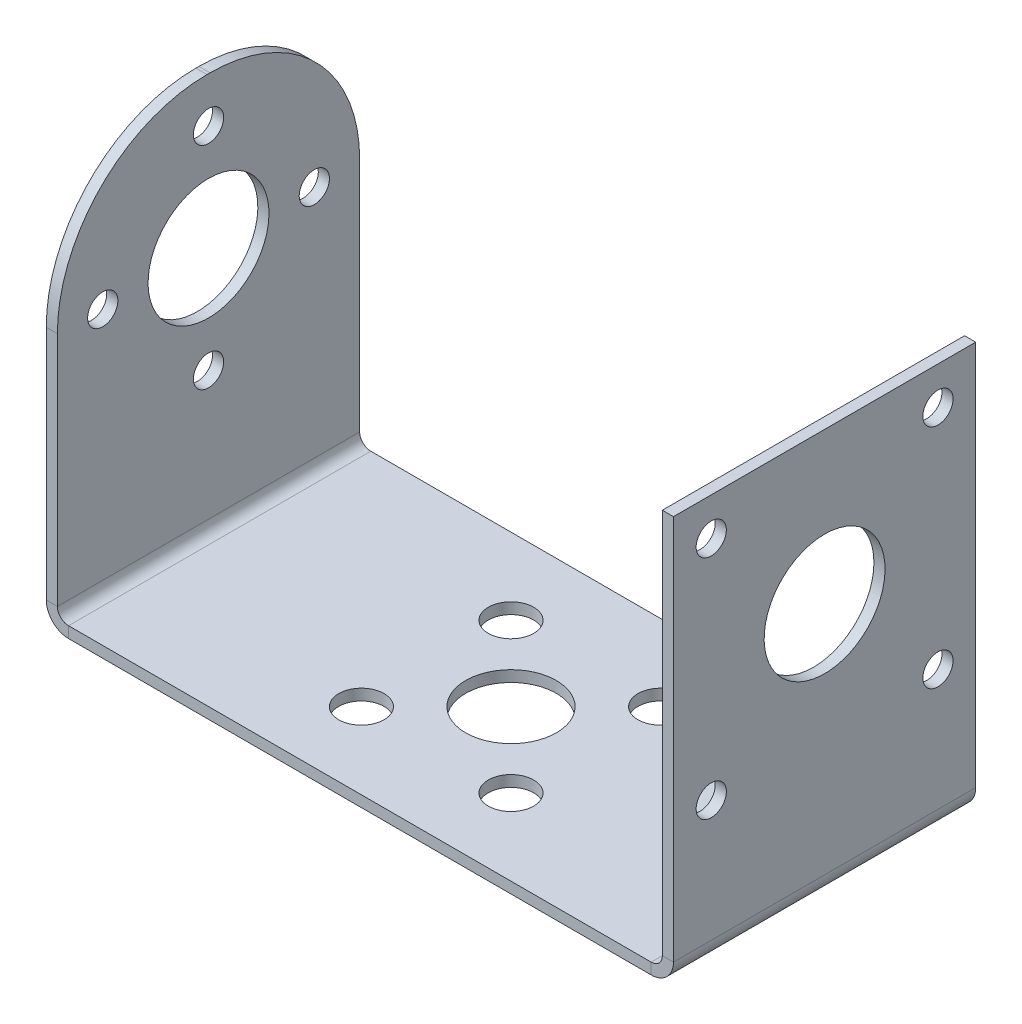
from build123d import *

# Parameters (mm, degrees)
SKETCH_1_W                       = 41.5
SKETCH_1_H                       = 20
SKETCH_1_R                       = 3
SKETCH_1_R_2                     = 1.5
SM_BASE_FLANGE_1_DEPTH           = 0.7366
SM_EDGE_FLANGE_1_STRIP_W         = 4.4196
SM_EDGE_FLANGE_1_STRIP_H         = 0.7366
SM_EDGE_FLANGE_1_STRIP_CUT_DEPTH = 20
SM_EDGE_FLANGE_1_DEPTH           = 20
SM_EDGE_FLANGE_1_PROFILE_R       = 1
SM_EDGE_FLANGE_1_PROFILE_R_2     = 4
SM_EDGE_FLANGE_1_FLAT_DEPTH      = 0.7366
SM_EDGE_FLANGE_2_STRIP_W         = 4.4196
SM_EDGE_FLANGE_2_STRIP_H         = 0.7366
SM_EDGE_FLANGE_2_STRIP_CUT_DEPTH = 20
SM_EDGE_FLANGE_2_DEPTH           = 20
CUT_EXTRUDE_START                = -10
SKETCH_14_R                      = 4
SKETCH_14_R_2                    = 1
CUT_EXTRUDE_1_DEPTH              = 10


# Sheet-metal steps are written as plain solids
with BuildPart() as part:
    # Sketch 1 → 基体-法兰1 (new body)
    with BuildSketch(Plane(origin=(0, 0, 0), x_dir=(1, 0, 0), z_dir=(0, 1, 0))):
        Rectangle(SKETCH_1_W, SKETCH_1_H)
        with Locations(Location((0, 0, 0), (0, 0, 270))):
            Circle(SKETCH_1_R, mode=Mode.SUBTRACT)
        with Locations(Location((4.9495, 4.9495, 0), (0, 0, 270))):
            Circle(SKETCH_1_R_2, mode=Mode.SUBTRACT)
        with Locations(Location((-4.9495, 4.9495, 0), (0, 0, 270))):
            Circle(SKETCH_1_R_2, mode=Mode.SUBTRACT)
        with Locations(Location((-4.9495, -4.9495, 0), (0, 0, 270))):
            Circle(SKETCH_1_R_2, mode=Mode.SUBTRACT)
        with Locations(Location((4.9495, -4.9495, 0), (0, 0, 270))):
            Circle(SKETCH_1_R_2, mode=Mode.SUBTRACT)
    extrude(amount=-SM_BASE_FLANGE_1_DEPTH)

    # 边线-法兰1 strip (across the edge) → 边线-法兰1 strip cut (cut)
    with BuildSketch(Plane(origin=(-20.75, 0, -10), x_dir=(1, 0, 0), z_dir=(0, 0, 1))):
        with Locations((-0.7366, -0.3683)):
            Rectangle(SM_EDGE_FLANGE_1_STRIP_W, SM_EDGE_FLANGE_1_STRIP_H)
    extrude(amount=SM_EDGE_FLANGE_1_STRIP_CUT_DEPTH, mode=Mode.SUBTRACT)

    # 边线-法兰1 bend section (across the edge) → 边线-法兰1 (add)
    with BuildSketch(Plane(origin=(-20.75, 0, -10), x_dir=(1, 0, 0), z_dir=(0, 0, 1))):
        with BuildLine():
            Line((0, 0.7366), (0.7366, 0.7366))
            ThreePointArc((0.7366, 0.7366), (0.952345145, 0.215745145), (1.4732, 0))
            Line((1.4732, 0), (1.4732, -0.7366))
            ThreePointArc((1.4732, -0.7366), (0.43149029, -0.30510971), (0, 0.7366))
        make_face()
    extrude(amount=SM_EDGE_FLANGE_1_DEPTH)

    # 边线-法兰1 profile (on flange) → 边线-法兰1 flat (add)
    with BuildSketch(Plane.ZY.offset(20.75)):
        with BuildLine():
            Line((-10, 0.7366), (10, 0.7366))
            Line((10, 0.7366), (10, 16.3634))
            ThreePointArc((10, 16.3634), (7.100357134, 23.363757134), (0.1, 26.2634))
            Line((0.1, 26.2634), (-0.1, 26.2634))
            ThreePointArc((-0.1, 26.2634), (-7.100357134, 23.363757134), (-10, 16.3634))
            Line((-10, 16.3634), (-10, 0.7366))
        make_face()
        with Locations((0, 9.2634)):
            Circle(SM_EDGE_FLANGE_1_PROFILE_R, mode=Mode.SUBTRACT)
        with Locations((7, 16.2634)):
            Circle(SM_EDGE_FLANGE_1_PROFILE_R, mode=Mode.SUBTRACT)
        with Locations((0, 16.2634)):
            Circle(SM_EDGE_FLANGE_1_PROFILE_R_2, mode=Mode.SUBTRACT)
        with Locations((-7, 16.2634)):
            Circle(SM_EDGE_FLANGE_1_PROFILE_R, mode=Mode.SUBTRACT)
        with Locations((0, 23.2634)):
            Circle(SM_EDGE_FLANGE_1_PROFILE_R, mode=Mode.SUBTRACT)
    extrude(amount=-SM_EDGE_FLANGE_1_FLAT_DEPTH)

    # 边线-法兰2 strip (across the edge) → 边线-法兰2 strip cut (cut)
    with BuildSketch(Plane(origin=(20.75, 0, 10), x_dir=(-1, 0, 0), z_dir=(0, 0, -1))):
        with Locations((-0.7366, -0.3683)):
            Rectangle(SM_EDGE_FLANGE_2_STRIP_W, SM_EDGE_FLANGE_2_STRIP_H)
    extrude(amount=SM_EDGE_FLANGE_2_STRIP_CUT_DEPTH, mode=Mode.SUBTRACT)

    # 边线-法兰2 section (across the edge) → 边线-法兰2 (add)
    with BuildSketch(Plane(origin=(20.75, 0, 10), x_dir=(-1, 0, 0), z_dir=(0, 0, -1))):
        with BuildLine():
            Line((0, 0.7366), (0, 26.2634))
            Line((0, 26.2634), (0.7366, 26.2634))
            Line((0.7366, 26.2634), (0.7366, 0.7366))
            ThreePointArc((0.7366, 0.7366), (0.952345145, 0.215745145), (1.4732, 0))
            Line((1.4732, 0), (1.4732, -0.7366))
            ThreePointArc((1.4732, -0.7366), (0.43149029, -0.30510971), (0, 0.7366))
        make_face()
    extrude(amount=SM_EDGE_FLANGE_2_DEPTH)

    # 草图14 → 切除-拉伸1 (cut)
    with BuildSketch(Plane(origin=(20.75, 0, 0), x_dir=(0, 0, -1), z_dir=(1, 0, 0)).offset(CUT_EXTRUDE_START)):
        with Locations(Location((0, 16.2634, 0), (0, 0, 90))):
            Circle(SKETCH_14_R)
        with Locations(Location((-7.5, 23.7634, 0), (0, 0, 90))):
            Circle(SKETCH_14_R_2)
        with Locations(Location((7.5, 23.7634, 0), (0, 0, 90))):
            Circle(SKETCH_14_R_2)
        with Locations(Location((7.5, 8.7634, 0), (0, 0, 90))):
            Circle(SKETCH_14_R_2)
        with Locations(Location((-7.5, 8.7634, 0), (0, 0, 90))):
            Circle(SKETCH_14_R_2)
    extrude(amount=CUT_EXTRUDE_1_DEPTH, mode=Mode.SUBTRACT)


solid = part.part
